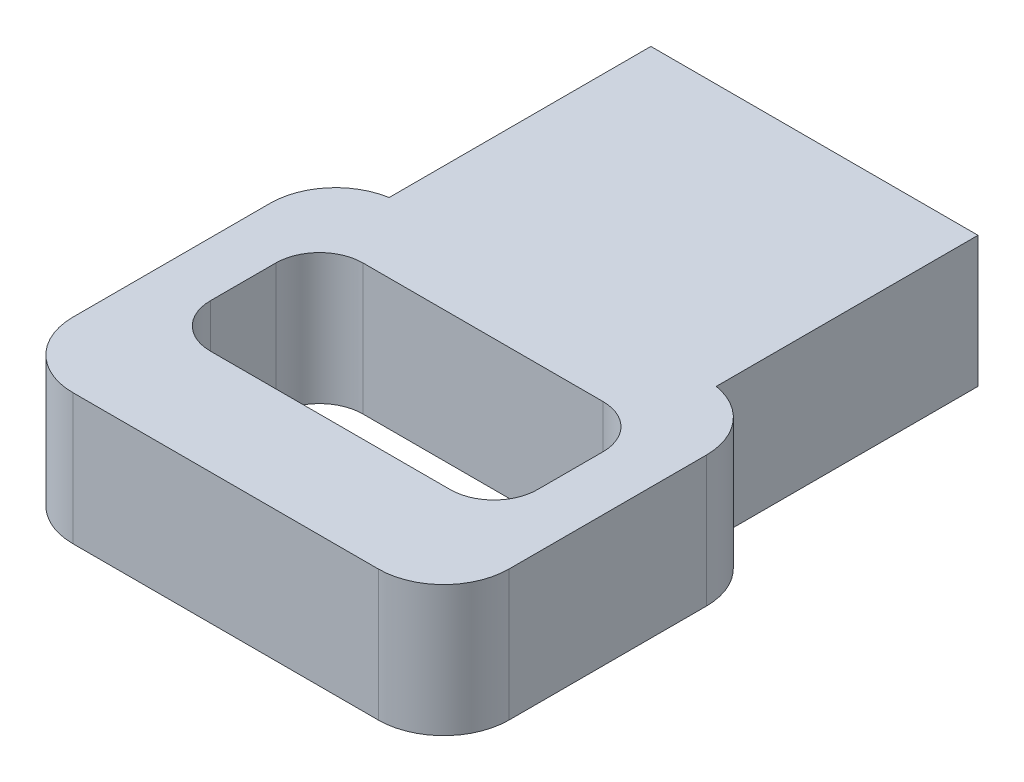
from build123d import *

# Parameters (mm, degrees)
SKETCH1_W           = 38.1
SKETCH1_H           = 15.24
BOSS_EXTRUDE2_DEPTH = 30.48
SKETCH2_W           = 50.8
SKETCH2_H           = 15.24
BOSS_EXTRUDE3_DEPTH = 38.1
SKETCH3_W           = 38.1
SKETCH3_H           = 17.78
CUT_EXTRUDE1_DEPTH  = 75.703641143
FILLET1_R           = 5.08
FILLET2_R           = 7.62


with BuildPart() as part:
    # Sketch1 → Boss-Extrude2 (new body)
    with BuildSketch(Plane.XY):
        Rectangle(SKETCH1_W, SKETCH1_H)
    extrude(amount=BOSS_EXTRUDE2_DEPTH)

    # Sketch2 → Boss-Extrude3 (add)
    with BuildSketch(Plane.XY.offset(30.48)):
        Rectangle(SKETCH2_W, SKETCH2_H)
    extrude(amount=BOSS_EXTRUDE3_DEPTH)

    # Sketch3 → Cut-Extrude1 (cut, through all)
    with BuildSketch(Plane.XZ.offset(7.62)):
        with Locations((0, 47.494377682)):
            Rectangle(SKETCH3_W, SKETCH3_H)
    extrude(amount=-CUT_EXTRUDE1_DEPTH, mode=Mode.SUBTRACT)

    # Fillet1
    fillet1_edges = [part.edges().sort_by_distance(p)[0] for p in [
        (-19.05, 0, 38.604377682),
        (-19.05, 0, 56.384377682),
        (19.05, 0, 56.384377682),
        (19.05, 0, 38.604377682),
    ]]
    fillet(fillet1_edges, radius=FILLET1_R)

    # Fillet2
    # the kernel refuses this fillet: 7.62 mm, written as the material it takes off along each edge
    with BuildSketch(Plane(origin=(-25.4, 26.403553311, 30.48), x_dir=(0, 0, 1), z_dir=(0, -1, 0)), Plane(origin=(25.4, -26.403553311, 30.48), x_dir=(0, 0, 1), z_dir=(0, 1, 0))) as fillet2_piece_1:
        with BuildLine():
            CenterArc((7.513421325, -7.62), FILLET2_R, 90, 80.405931773)
            Line((0, -6.35), (-0.150268426, -6.3246))
            ThreePointArc((-0.150268426, -6.3246), (-0.1524, -3.175), (-0.1524, 0))
            Line((-0.1524, 0), (0, 0.1524))
            Line((0, 0.1524), (7.513421325, 0.1524))
            Line((7.513421325, 0.1524), (7.513421325, 0))
        make_face()
    extrude(amount=52.807106623, mode=Mode.SUBTRACT)
    with BuildSketch(Plane(origin=(25.4, -26.67, 68.58), x_dir=(-1, 0, 0), z_dir=(0, 1, 0))) as fillet2_piece_2:
        with BuildLine():
            CenterArc((FILLET2_R, -FILLET2_R), FILLET2_R, 90, 90)
            Line((0, -FILLET2_R), (-FILLET2_R * 0.02, -FILLET2_R))
            Line((-FILLET2_R * 0.02, -FILLET2_R), (-FILLET2_R * 0.02, FILLET2_R * 0.02))
            Line((-FILLET2_R * 0.02, FILLET2_R * 0.02), (FILLET2_R, FILLET2_R * 0.02))
            Line((FILLET2_R, FILLET2_R * 0.02), (FILLET2_R, 0))
        make_face()
    extrude(amount=53.34, mode=Mode.SUBTRACT)
    with BuildSketch(Plane(origin=(-25.4, 26.67, 68.58), x_dir=(0, 0, -1), z_dir=(0, -1, 0))) as fillet2_piece_3:
        with BuildLine():
            CenterArc((FILLET2_R, FILLET2_R), FILLET2_R, 180, 90)
            Line((0, FILLET2_R), (-FILLET2_R * 0.02, FILLET2_R))
            Line((-FILLET2_R * 0.02, FILLET2_R), (-FILLET2_R * 0.02, -FILLET2_R * 0.02))
            Line((-FILLET2_R * 0.02, -FILLET2_R * 0.02), (FILLET2_R, -FILLET2_R * 0.02))
            Line((FILLET2_R, -FILLET2_R * 0.02), (FILLET2_R, 0))
        make_face()
    extrude(amount=53.34, mode=Mode.SUBTRACT)


solid = part.part
